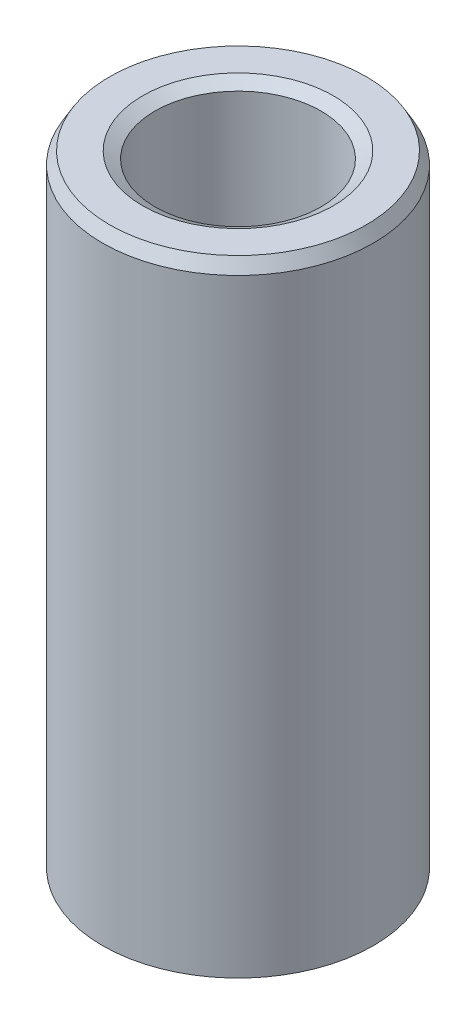
from build123d import *
from OCP.BRepFilletAPI import BRepFilletAPI_MakeChamfer

# Parameters (mm, degrees)
SKETCH1_R           = 42.5
BOSS_EXTRUDE1_DEPTH = 197.031258914
SKETCH2_R           = 26.072000786
CUT_EXTRUDE1_DEPTH  = 206.994701362
CHAMFER1_SIZE       = 3.8548422
CHAMFER1_SIZE2      = 2.225594182


with BuildPart() as part:
    # Sketch1 → Boss-Extrude1 (new body)
    with BuildSketch(Plane(origin=(0, 0, 0), x_dir=(1, 0, 0), z_dir=(0, 1, 0))):
        Circle(SKETCH1_R)
    extrude(amount=BOSS_EXTRUDE1_DEPTH)

    # Sketch2 → Cut-Extrude1 (cut, through all)
    with BuildSketch(Plane(origin=(0, 0, 0), x_dir=(1, 0, 0), z_dir=(0, 1, 0))):
        Circle(SKETCH2_R)
    extrude(amount=CUT_EXTRUDE1_DEPTH, mode=Mode.SUBTRACT)

    # Chamfer1: one chamfer whose edges measure the first distance from different faces: ONE call of the kernel's chamfer builder (chamfer() names one face for all edges)
    chamfer1_edges_1 = [part.edges().sort_by_distance(p)[0] for p in [
        (-26.072000786, 197.031258914, 0),
    ]]
    chamfer1_side_1 = [part.faces().sort_by_distance(p)[0] for p in [
        (-41.297918472, 197.031258914, 0),
    ]]
    chamfer1_edges_2 = [part.edges().sort_by_distance(p)[0] for p in [
        (-26.072000786, 0, 0),
    ]]
    chamfer1_side_2 = [part.faces().sort_by_distance(p)[0] for p in [
        (-26.072000786, 98.515629457, 0),
    ]]
    chamfer1_edges_3 = [part.edges().sort_by_distance(p)[0] for p in [
        (-42.5, 0, 0),
    ]]
    chamfer1_side_3 = [part.faces().sort_by_distance(p)[0] for p in [
        (-41.297918472, 0, 0),
    ]]
    chamfer1_edges_4 = [part.edges().sort_by_distance(p)[0] for p in [
        (-42.5, 197.031258914, 0),
    ]]
    chamfer1_side_4 = [part.faces().sort_by_distance(p)[0] for p in [
        (-42.5, 98.515629457, 0),
    ]]
    chamfer1 = BRepFilletAPI_MakeChamfer(part.part.solid().wrapped)
    for e in chamfer1_edges_1:
        chamfer1.Add(CHAMFER1_SIZE, CHAMFER1_SIZE2, e.wrapped, chamfer1_side_1[0].wrapped)  # the first distance lies on this face
    for e in chamfer1_edges_2:
        chamfer1.Add(CHAMFER1_SIZE, CHAMFER1_SIZE2, e.wrapped, chamfer1_side_2[0].wrapped)  # the first distance lies on this face
    for e in chamfer1_edges_3:
        chamfer1.Add(CHAMFER1_SIZE, CHAMFER1_SIZE2, e.wrapped, chamfer1_side_3[0].wrapped)  # the first distance lies on this face
    for e in chamfer1_edges_4:
        chamfer1.Add(CHAMFER1_SIZE, CHAMFER1_SIZE2, e.wrapped, chamfer1_side_4[0].wrapped)  # the first distance lies on this face
    add(Compound.cast(chamfer1.Shape()), mode=Mode.REPLACE)


solid = part.part
